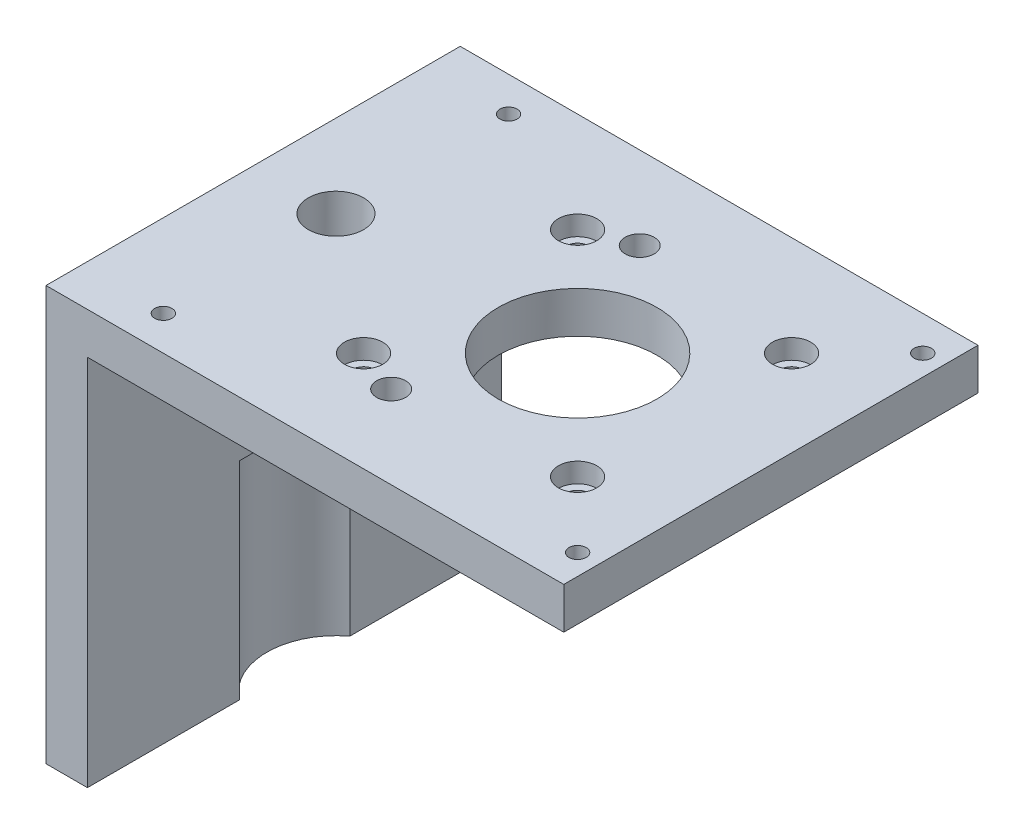
from build123d import *

# Parameters (mm, degrees)
BOSS_EXTRUDE1_DEPTH                            = 60
SKETCH2_R                                      = 11.5
CUT_EXTRUDE1_DEPTH                             = 114.247516529
CBORE_FOR_4_SOCKET_HEAD_CAP_SCREW1_D           = 3.2639
CBORE_FOR_4_SOCKET_HEAD_CAP_SCREW1_CBORE_D     = 5.55752
CBORE_FOR_4_SOCKET_HEAD_CAP_SCREW1_CBORE_DEPTH = 2.8448
M3_TAPPED_HOLE1_D                              = 2.5
M3_TAPPED_HOLE1_DEPTH                          = 8.5
M3_TAPPED_HOLE1_TIP                            = 0.751075774
M5_TAPPED_HOLE1_D                              = 4.2
SKETCH11_R                                     = 4
CUT_EXTRUDE2_DEPTH                             = 114.247516529
SKETCH16_R                                     = 10
CUT_EXTRUDE4_DEPTH                             = 30


with BuildPart() as part:
    # Sketch1 → Boss-Extrude1 (new body)
    with BuildSketch(Plane.XY):
        Polygon((0, 0), (6, 0), (6, 54), (75, 54), (75, 60), (0, 60), align=None)
    extrude(amount=BOSS_EXTRUDE1_DEPTH)

    # Sketch2 → Cut-Extrude1 (cut, through all)
    with BuildSketch(Plane(origin=(0, 60, 0), x_dir=(1, 0, 0), z_dir=(0, 1, 0))):
        with Locations((47, -30)):
            Circle(SKETCH2_R)
    extrude(amount=-CUT_EXTRUDE1_DEPTH, mode=Mode.SUBTRACT)

    # CBORE for #4 Socket Head Cap Screw1 (through all)
    with Locations(Plane(origin=(0, 60, 0), x_dir=(-1, 0, 0), z_dir=(0, 1, 0))):
        with Locations((-31.5, 45.5), (-62.5, 45.5), (-31.5, 14.5), (-62.5, 14.5)):
            CounterBoreHole(CBORE_FOR_4_SOCKET_HEAD_CAP_SCREW1_D / 2, CBORE_FOR_4_SOCKET_HEAD_CAP_SCREW1_CBORE_D / 2, CBORE_FOR_4_SOCKET_HEAD_CAP_SCREW1_CBORE_DEPTH)

    # M3 Tapped Hole1
    with Locations(Plane(origin=(0, 60, 0), x_dir=(-1, 0, 0), z_dir=(0, 1, 0))):
        with Locations((-12, 55), (-72, 55), (-12, 5), (-72, 5)):
            Hole(M3_TAPPED_HOLE1_D / 2, depth=M3_TAPPED_HOLE1_DEPTH)
            with Locations((0, 0, -(M3_TAPPED_HOLE1_DEPTH + M3_TAPPED_HOLE1_TIP / 2))):  # 118° drill point
                Cone(0, M3_TAPPED_HOLE1_D / 2, M3_TAPPED_HOLE1_TIP, mode=Mode.SUBTRACT)

    # M5 Tapped Hole1 (through all)
    with Locations(Plane(origin=(0, 60, 0), x_dir=(-1, 0, 0), z_dir=(0, 1, 0))):
        with Locations((-38, 12), (-38, 48)):
            Hole(M5_TAPPED_HOLE1_D / 2)

    # Sketch11 → Cut-Extrude2 (cut, through all)
    with BuildSketch(Plane(origin=(0, 60, 0), x_dir=(1, 0, 0), z_dir=(0, 1, 0))):
        with Locations((12, -30)):
            Circle(SKETCH11_R)
    extrude(amount=-CUT_EXTRUDE2_DEPTH, mode=Mode.SUBTRACT)

    # Sketch16 → Cut-Extrude4 (cut)
    with BuildSketch(Plane.XZ):
        with Locations((12, 30)):
            Circle(SKETCH16_R)
    extrude(amount=-CUT_EXTRUDE4_DEPTH, mode=Mode.SUBTRACT)


solid = part.part
